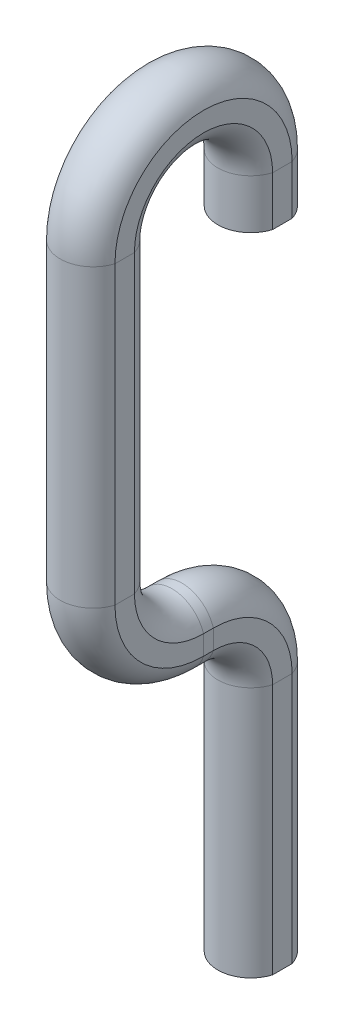
from build123d import *


with BuildPart() as part:
    # Sweep1: sweep along a path in Sketch1
    with BuildLine(Plane.YZ) as sweep1_path:
        Line((0, 0), (64.77, 0))
        ThreePointArc((64.77, 0), (77.342358569, 5.207641431), (82.55, 17.78))
        Line((82.55, 17.78), (82.55, 20.32))
        ThreePointArc((82.55, 20.32), (88.501590206, 34.688409794), (102.87, 40.64))
        Line((102.87, 40.64), (179.07, 40.64))
        ThreePointArc((179.07, 40.64), (199.39, 20.32), (179.07, 0))
        Line((179.07, 0), (166.37, 0))
    # Sketch2 → Sweep1 (sweep)
    with BuildSketch(Plane(origin=(0, 0, 0), x_dir=(-1, 0, 0), z_dir=(0, 1, 0))):
        with BuildLine():
            Line((-8.128, 2.5146), (-8.128, -2.5146))
            ThreePointArc((-8.128, -2.5146), (0, -8.505923095), (8.128, -2.5146))
            Line((8.128, -2.5146), (8.128, 2.5146))
            ThreePointArc((8.128, 2.5146), (0, 8.505923095), (-8.128, 2.5146))
        make_face()
    sweep(path=sweep1_path.line)


solid = part.part
